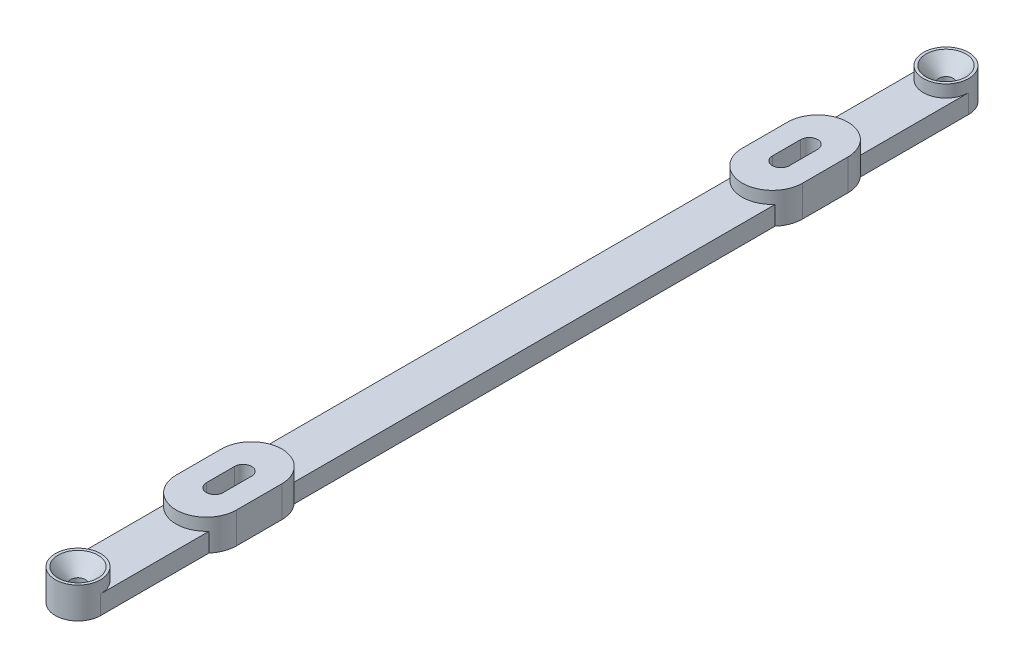
from build123d import *

# Parameters (mm, degrees)
ARM_BASE_SKETCH_W                  = 12
ARM_BASE_SKETCH_H                  = 115
ARM_BASE_EXTRUDE_DEPTH             = 5
SCREW_BASES_SKETCH_R               = 6
SCREW_BASES_EXTRUDE_DEPTH          = 8.25
POWER_SUPPLY_MOUNTING_SLOT_DEPTH   = 8.25
POWER_SUPPLY_MOUNTING_SLOT_2_DEPTH = 3.1
NO_6_MOUNTING_SCREWS_D             = 3.7973
NO_6_MOUNTING_SCREWS_CSINK_D       = 10.563733
NO_6_MOUNTING_SCREWS_CSINK_ANGLE   = 82


# Read off the part's stored shape, not the designer's step: Power Supply Mounting Slot
with BuildPart() as part:
    # Arm Base Sketch → Arm Base Extrude (new body)
    with BuildSketch(Plane(origin=(0, 0, 0), x_dir=(1, 0, 0), z_dir=(0, 1, 0))):
        with Locations((0, 57.5)):
            Rectangle(ARM_BASE_SKETCH_W, ARM_BASE_SKETCH_H)
    extrude(amount=ARM_BASE_EXTRUDE_DEPTH)

    # Screw Bases Sketch → Screw Bases Extrude (add)
    with BuildSketch(Plane.XZ):
        with Locations(Location((0, -115, 0), (0, 0, 270))):
            Circle(SCREW_BASES_SKETCH_R)
        with BuildLine():
            Line((-8, -81), (-8, -69))
            ThreePointArc((-8, -69), (0, -61), (8, -69))
            Line((8, -69), (8, -81))
            ThreePointArc((8, -81), (0, -89), (-8, -81))
        make_face()
    extrude(amount=-SCREW_BASES_EXTRUDE_DEPTH)

    # Power Supply Mounting Slot outline → Power Supply Mounting Slot (cut)
    with BuildSketch(Plane(origin=(0, 0, 0), x_dir=(1, 0, 0), z_dir=(0, 1, 0))):
        with BuildLine():
            ThreePointArc((-2.25, 71.25), (0, 69), (2.25, 71.25))
            Line((2.25, 71.25), (2.25, 78.75))
            ThreePointArc((2.25, 78.75), (0, 81), (-2.25, 78.75))
            Line((-2.25, 78.75), (-2.25, 71.25))
        make_face()
    extrude(amount=POWER_SUPPLY_MOUNTING_SLOT_DEPTH, mode=Mode.SUBTRACT)

    # Power Supply Mounting Slot 2 outline → Power Supply Mounting Slot 2 (cut)
    with BuildSketch(Plane(origin=(0, 0, 0), x_dir=(1, 0, 0), z_dir=(0, 1, 0))):
        with BuildLine():
            ThreePointArc((-4.5, 71.25), (0, 66.75), (4.5, 71.25))
            Line((4.5, 71.25), (4.5, 78.75))
            ThreePointArc((4.5, 78.75), (0, 83.25), (-4.5, 78.75))
            Line((-4.5, 78.75), (-4.5, 71.25))
        make_face()
        with BuildLine():
            Line((2.25, 78.75), (2.25, 71.25))
            ThreePointArc((2.25, 71.25), (0, 69), (-2.25, 71.25))
            Line((-2.25, 71.25), (-2.25, 78.75))
            ThreePointArc((-2.25, 78.75), (0, 81), (2.25, 78.75))
        make_face(mode=Mode.SUBTRACT)
    extrude(amount=POWER_SUPPLY_MOUNTING_SLOT_2_DEPTH, mode=Mode.SUBTRACT)

    # No. 6 Mounting Screws (through all)
    with Locations(Plane(origin=(0, 8.25, 0), x_dir=(1, 0, 0), z_dir=(0, 1, 0))):
        with Locations((0, 115)):
            CounterSinkHole(NO_6_MOUNTING_SCREWS_D / 2, NO_6_MOUNTING_SCREWS_CSINK_D / 2, counter_sink_angle=NO_6_MOUNTING_SCREWS_CSINK_ANGLE)

    # Mirror 2: part across plane


with BuildPart() as part_1:
    add(part.part)
    add(part.part.mirror(Plane(origin=(6, 5, 0), x_dir=(1, 0, 0), z_dir=(0, 0, -1))))


solid = part_1.part
